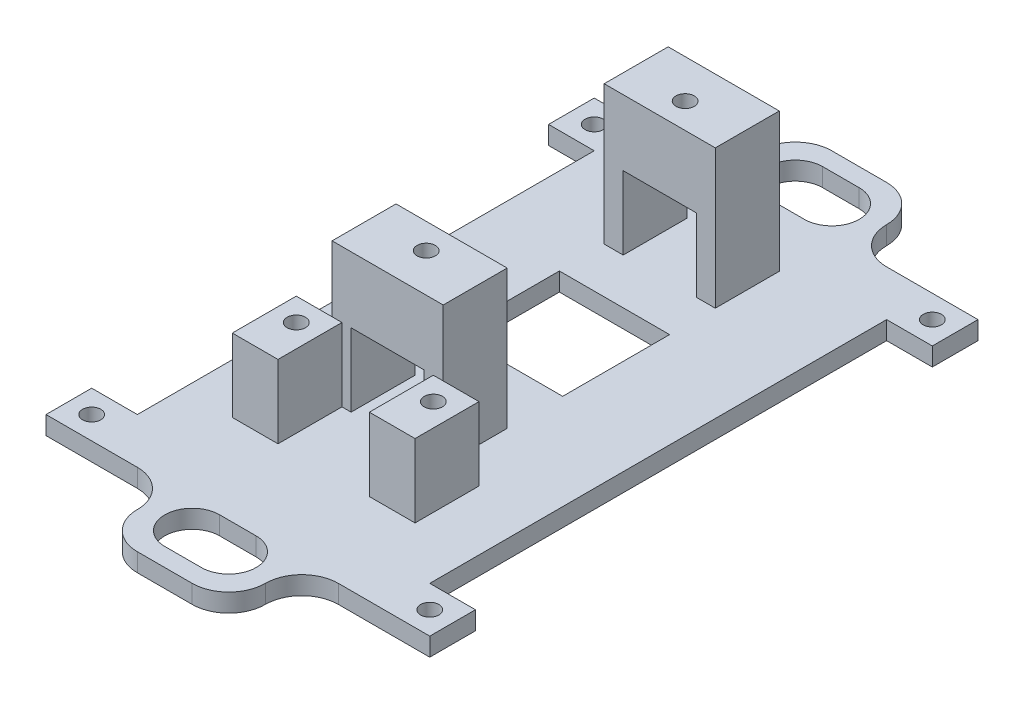
from build123d import *

# Parameters (mm, degrees)
CROQUIS1_R                 = 1
SALIENTE_EXTRUIR2_DEPTH    = 2
SALIENTE_EXTRUIR3_DEPTH    = 15.2
CROQUIS3_R                 = 1
CORTAR_EXTRUIR1_DEPTH      = 8
CROQUIS4_R                 = 1
SALIENTE_EXTRUIR4_DEPTH    = 8
CORTAR_EXTRUIR2_DEPTH      = 51.918821667
CORTAR_EXTRUIR2_DEPTH_BACK = 51.918821667
SALIENTE_EXTRUIR6_DEPTH    = 2
REDONDEO1_R                = 4
CORTAR_EXTRUIR3_DEPTH      = 10


with BuildPart() as part:
    # Croquis1 → Saliente-Extruir2 (new body)
    with BuildSketch(Plane(origin=(0, 0, 0), x_dir=(1, 0, 0), z_dir=(0, 1, 0))):
        Polygon((-21, 30), (-21, 25), (-16, 25), (-16, -25), (-21, -25), (-21, -30), (21, -30), (21, -25), (16, -25), (16, 25), (21, 25), (21, 30), align=None)
        with Locations(Location((-18.5, -27.5, 0), (0, 0, 270))):
            Circle(CROQUIS1_R, mode=Mode.SUBTRACT)
        with Locations(Location((-18.5, 27.5, 0), (0, 0, 270))):
            Circle(CROQUIS1_R, mode=Mode.SUBTRACT)
        with Locations(Location((18.5, 27.5, 0), (0, 0, 270))):
            Circle(CROQUIS1_R, mode=Mode.SUBTRACT)
        with Locations(Location((18.5, -27.5, 0), (0, 0, 270))):
            Circle(CROQUIS1_R, mode=Mode.SUBTRACT)
    extrude(amount=SALIENTE_EXTRUIR2_DEPTH)

    # Croquis2 → Saliente-Extruir3 (add)
    with BuildSketch(Plane(origin=(0, 2, 0), x_dir=(1, 0, 0), z_dir=(0, 1, 0))):
        Polygon((5.549377546, 23.7), (5.549377546, 16.7), (-0.530622454, 16.7), (-6.610622454, 16.7), (-6.610622454, 23.7), align=None)
        Polygon((-6.610622454, -13.08), (5.549377546, -13.08), (5.549377546, -6.08), (-0.530622454, -6.08), (-6.610622454, -6.08), align=None)
    extrude(amount=SALIENTE_EXTRUIR3_DEPTH)

    # Croquis3 → Cortar-Extruir1 (cut)
    with BuildSketch(Plane(origin=(0, 17.2, 0), x_dir=(1, 0, 0), z_dir=(0, 1, 0))):
        with Locations(Location((-0.530622454, 19.48, 0), (0, 0, 270))):
            Circle(CROQUIS3_R)
        with Locations(Location((-0.530622454, -8.86, 0), (0, 0, 270))):
            Circle(CROQUIS3_R)
    extrude(amount=-CORTAR_EXTRUIR1_DEPTH, mode=Mode.SUBTRACT)

    # Croquis4 → Saliente-Extruir4 (add)
    # profile 1 of 2: a face of its own
    with BuildSketch(Plane(origin=(0, 2, 0), x_dir=(1, 0, 0), z_dir=(0, 1, 0))):
        Polygon((-5.530622454, -20.08), (-5.530622454, -13.08), (-6.610622454, -13.08), (-10.530622454, -13.08), (-10.530622454, -20.08), align=None)
        with Locations(Location((-8.030622454, -15.58, 0), (0, 0, 270))):
            Circle(CROQUIS4_R, mode=Mode.SUBTRACT)
    # profile 2 of 2: a face of its own
    with BuildSketch(Plane(origin=(0, 2, 0), x_dir=(1, 0, 0), z_dir=(0, 1, 0))):
        Polygon((9.469377546, -20.08), (9.469377546, -13.08), (5.549377546, -13.08), (4.469377546, -13.08), (4.469377546, -20.08), align=None)
        with Locations(Location((6.969377546, -15.58, 0), (0, 0, 270))):
            Circle(CROQUIS4_R, mode=Mode.SUBTRACT)
    extrude(amount=SALIENTE_EXTRUIR4_DEPTH)

    # Croquis5 → Cortar-Extruir2 (cut, two sides: drawn at the far end of the back side and taken through both)
    with BuildSketch(Plane.XY.offset(13.08).offset(-CORTAR_EXTRUIR2_DEPTH_BACK)):
        Polygon((-4.530622454, 2), (-0.530622454, 2), (3.469377546, 2), (3.469377546, 10), (-4.530622454, 10), align=None)
    extrude(amount=CORTAR_EXTRUIR2_DEPTH + CORTAR_EXTRUIR2_DEPTH_BACK, mode=Mode.SUBTRACT)

    # Croquis6 → Saliente-Extruir6 (add)
    with BuildSketch(Plane(origin=(0, 2, 0), x_dir=(1, 0, 0), z_dir=(0, 1, 0))):
        with BuildLine():
            Line((3.5, 30), (5, 30))
            Line((5, 30), (7, 30))
            Line((7, 30), (7, 34))
            ThreePointArc((7, 34), (5.828427125, 36.828427125), (3, 38))
            Line((3, 38), (-3, 38))
            ThreePointArc((-3, 38), (-5.828427125, 36.828427125), (-7, 34))
            Line((-7, 34), (-7, 30))
            Line((-7, 30), (-5, 30))
            Line((-5, 30), (-3.5, 30))
            Line((-3.5, 30), (-2, 30))
            ThreePointArc((-2, 30), (-4.121320344, 30.878679656), (-5, 33))
            ThreePointArc((-5, 33), (-4.121320344, 35.121320344), (-2, 36))
            Line((-2, 36), (0, 36))
            Line((0, 36), (2, 36))
            ThreePointArc((2, 36), (4.121320344, 35.121320344), (5, 33))
            ThreePointArc((5, 33), (4.121320344, 30.878679656), (2, 30))
            Line((2, 30), (3.5, 30))
        make_face()
        with BuildLine():
            Line((7, -34), (7, -30))
            Line((7, -30), (5, -30))
            Line((5, -30), (3.5, -30))
            Line((3.5, -30), (2, -30))
            ThreePointArc((2, -30), (4.121320344, -30.878679656), (5, -33))
            ThreePointArc((5, -33), (4.121320344, -35.121320344), (2, -36))
            Line((2, -36), (0, -36))
            Line((0, -36), (-2, -36))
            ThreePointArc((-2, -36), (-4.121320344, -35.121320344), (-5, -33))
            ThreePointArc((-5, -33), (-4.121320344, -30.878679656), (-2, -30))
            Line((-2, -30), (-3.5, -30))
            Line((-3.5, -30), (-5, -30))
            Line((-5, -30), (-7, -30))
            Line((-7, -30), (-7, -34))
            ThreePointArc((-7, -34), (-5.828427125, -36.828427125), (-3, -38))
            Line((-3, -38), (3, -38))
            ThreePointArc((3, -38), (5.828427125, -36.828427125), (7, -34))
        make_face()
    extrude(amount=-SALIENTE_EXTRUIR6_DEPTH)

    # Redondeo1
    redondeo1_edges = [part.edges().sort_by_distance(p)[0] for p in [
        (7, 1, -30),
        (-7, 1, -30),
        (-7, 1, 30),
        (7, 1, 30),
    ]]
    fillet(redondeo1_edges, radius=REDONDEO1_R - 0.0001)  # a hair under: the kernel refuses the full size

    # Croquis7 → Cortar-Extruir3 (cut)
    with BuildSketch(Plane(origin=(0, 2, 0), x_dir=(1, 0, 0), z_dir=(0, 1, 0))):
        Polygon((0, 0), (-6.51429836, 0), (-6.51429836, 11.7), (0, 11.7), (5.54570164, 11.7), (5.54570164, 0), align=None)
    extrude(amount=-CORTAR_EXTRUIR3_DEPTH, mode=Mode.SUBTRACT)


solid = part.part
